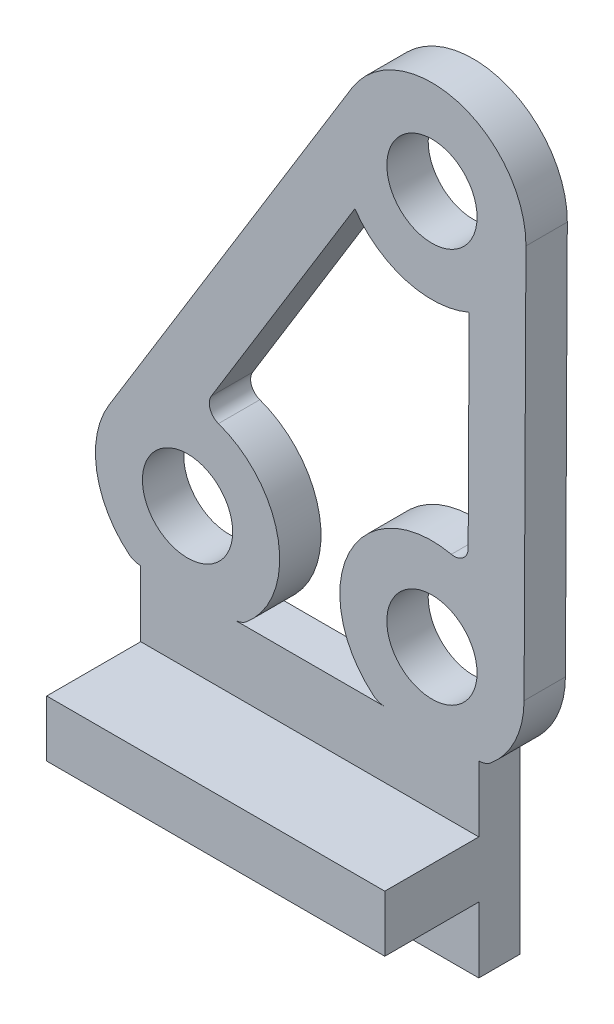
from build123d import *

# Parameters (mm, degrees)
STOCK_BASE_SKEWED_1_START     = 6.9
STOCK_BASE_SKEWED_1_OUTLINE_R = 1.2
STOCK_BASE_SKEWED_1_DEPTH     = 1.1
SKETCH1_W                     = 2.5
SKETCH1_H                     = 1.5
BOSS_EXTRUDE1_DEPTH           = 8.991987159


# Read off the part's stored shape, not the designer's step: Stock-Base_skewed-1
with BuildPart() as part:
    # Stock-Base_skewed-1 outline → Stock-Base_skewed-1 (new body)
    with BuildSketch(Plane.XY.offset(STOCK_BASE_SKEWED_1_START)):
        with BuildLine():
            ThreePointArc((8.999971655, 10.488095238), (7.184905048, 12.904351279), (4.369026688, 11.807269193))
            Line((4.369026688, 11.807269193), (-2.088353846, 1.281123809))
            ThreePointArc((-2.088353846, 1.281123809), (-2.417250501, -0.399249317), (-1.565479113, -1.884615385))
            ThreePointArc((-1.565479113, -1.884615385), (-1.415835135, -1.970269972), (-1.245993579, -2))
            Line((-1.245993579, -2), (-1.245993579, -7))
            Line((-1.245993579, -7), (7.745993579, -7))
            Line((7.745993579, -7), (7.745993579, -2))
            ThreePointArc((7.745993579, -2), (7.915835135, -1.970269972), (8.065479113, -1.884615385))
            ThreePointArc((8.065479113, -1.884615385), (8.715388585, -1.046209071), (8.949972222, -0.011666667))
            Line((8.949972222, -0.011666667), (8.999971655, 10.488095238))
        make_face()
        Circle(STOCK_BASE_SKEWED_1_OUTLINE_R, mode=Mode.SUBTRACT)
        with Locations((6.5, 0)):
            Circle(STOCK_BASE_SKEWED_1_OUTLINE_R, mode=Mode.SUBTRACT)
        with BuildLine():
            Line((0.632085047, 2.847123137), (4.449478669, 9.069838376))
            ThreePointArc((4.449478669, 9.069838376), (5.815094952, 8.095648721), (7.489077768, 8.203976226))
            Line((7.489077768, 8.203976226), (7.463119607, 2.75282442))
            ThreePointArc((7.463119607, 2.75282442), (7.325518036, 2.467571215), (7.017292273, 2.394766941))
            ThreePointArc((7.017292273, 2.394766941), (4.297058288, 1.072169676), (4.934520887, -1.884615385))
            ThreePointArc((4.934520887, -1.884615385), (5.084164865, -1.970269972), (5.254006421, -2))
            Line((5.254006421, -2), (1.245993579, -2))
            ThreePointArc((1.245993579, -2), (1.415835135, -1.970269972), (1.565479113, -1.884615385))
            ThreePointArc((1.565479113, -1.884615385), (2.412392059, 0.427626653), (0.822306837, 2.307880297))
            ThreePointArc((0.822306837, 2.307880297), (0.598713954, 2.532178772), (0.632085047, 2.847123137))
        make_face(mode=Mode.SUBTRACT)
        with Locations((6.5, 10.5)):
            Circle(STOCK_BASE_SKEWED_1_OUTLINE_R, mode=Mode.SUBTRACT)
    extrude(amount=STOCK_BASE_SKEWED_1_DEPTH)

    # Sketch1 → Boss-Extrude1 (add)
    with BuildSketch(Plane(origin=(7.745993579, 0, 0), x_dir=(0, 0, -1), z_dir=(1, 0, 0))):
        with Locations((-9.25, -4.5)):
            Rectangle(SKETCH1_W, SKETCH1_H)
    extrude(amount=-BOSS_EXTRUDE1_DEPTH)


solid = part.part
